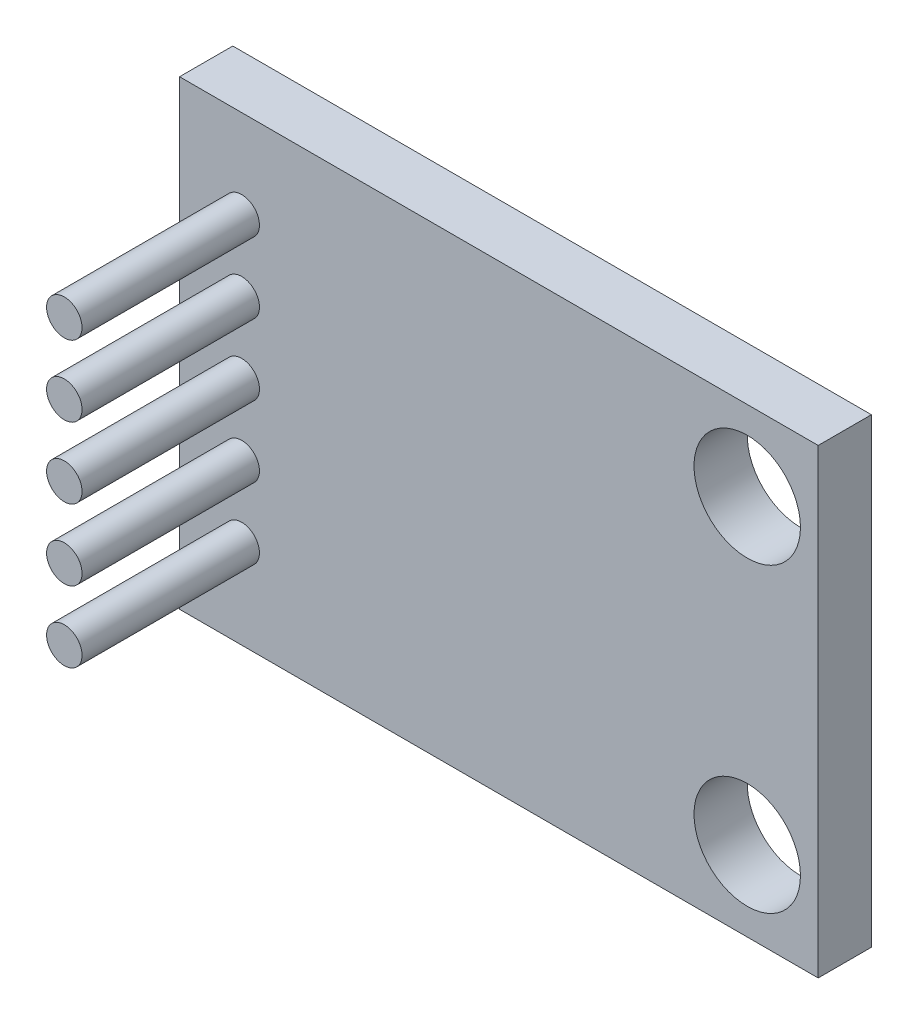
from build123d import *

# Parameters (mm, degrees)
SKETCH1_W           = 18
SKETCH1_H           = 13
BOSS_EXTRUDE1_DEPTH = 1.5
SKETCH2_R           = 0.5
BOSS_EXTRUDE2_DEPTH = 5
CUT_EXTRUDE1_REACH  = 186.611
SKETCH3_R           = 1.5


with BuildPart() as part:
    # Sketch1 → Boss-Extrude1 (new body)
    with BuildSketch(Plane.XY):
        with Locations((165.583059714, 53.307197022)):
            Rectangle(SKETCH1_W, SKETCH1_H)
    extrude(amount=BOSS_EXTRUDE1_DEPTH)

    # Sketch2 → Boss-Extrude2 (add)
    with BuildSketch(Plane.XY.offset(1.5)):
        with Locations((158.334176002, 53.307197022)):
            Circle(SKETCH2_R)
        with Locations((158.334176002, 55.307197022)):
            Circle(SKETCH2_R)
        with Locations((158.334176002, 57.307197022)):
            Circle(SKETCH2_R)
        with Locations((158.334176002, 51.307197022)):
            Circle(SKETCH2_R)
        with Locations((158.334176002, 49.307197022)):
            Circle(SKETCH2_R)
    extrude(amount=BOSS_EXTRUDE2_DEPTH)

    # Sketch3 → Cut-Extrude1 (cut, up to next)
    with BuildSketch(Plane.XY.offset(1.5), mode=Mode.PRIVATE) as cut_extrude1_sk1:
        with Locations((172.583059714, 57.557197022)):
            Circle(SKETCH3_R)
    cut_extrude1_tool1 = extrude(cut_extrude1_sk1.sketch, amount=-CUT_EXTRUDE1_REACH, mode=Mode.PRIVATE) & part.part
    # Sketch3 → Cut-Extrude1 (cut, up to next)
    with BuildSketch(Plane.XY.offset(1.5), mode=Mode.PRIVATE) as cut_extrude1_sk2:
        with Locations((172.583059714, 49.057197022)):
            Circle(SKETCH3_R)
    cut_extrude1_tool2 = extrude(cut_extrude1_sk2.sketch, amount=-CUT_EXTRUDE1_REACH, mode=Mode.PRIVATE) & part.part
    add(cut_extrude1_tool1.solids().sort_by_distance((172.58306, 57.557197, 1.5))[0], mode=Mode.SUBTRACT)
    add(cut_extrude1_tool2.solids().sort_by_distance((172.58306, 49.057197, 1.5))[0], mode=Mode.SUBTRACT)


solid = part.part
